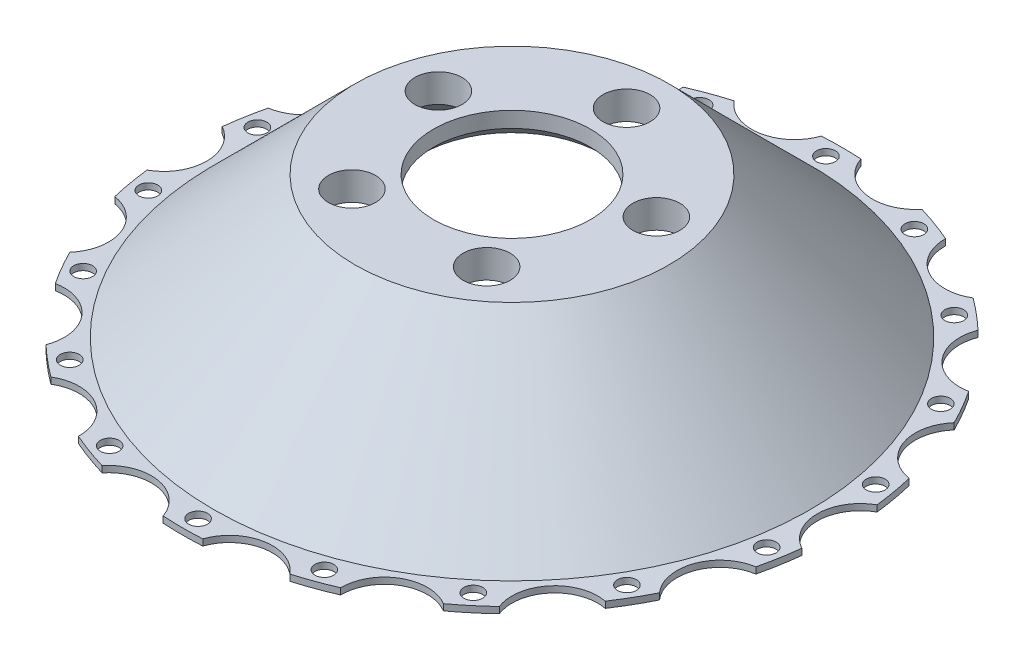
from build123d import *

# Parameters (mm, degrees)
SKETCH1_R           = 105
BOSS_EXTRUDE1_DEPTH = 2
BOSS_EXTRUDE2_START = 2
SKETCH2_R           = 95
BOSS_EXTRUDE2_DEPTH = 45
BOSS_EXTRUDE2_TAPER = 45
CUT_EXTRUDE2_START  = 2
SKETCH3_R           = 95
CUT_EXTRUDE2_DEPTH  = 40
CUT_EXTRUDE2_DRAFT  = -45
CUT_EXTRUDE3_REACH  = 157.753
SKETCH4_R           = 25
CHAMFER7_SIZE       = 4
CUT_EXTRUDE4_REACH  = 157.753
SKETCH7_R           = 7.5
CIRPATTERN1_COUNT   = 5
CUT_EXTRUDE5_REACH  = 157.753
SKETCH10_R          = 3
CIRPATTERN2_COUNT   = 18
CUT_EXTRUDE7_REACH  = 157.161
SKETCH12_R          = 13.691963716
CIRPATTERN4_COUNT   = 18


with BuildPart() as part:
    # Sketch1 → Boss-Extrude1 (new body)
    with BuildSketch(Plane(origin=(0, 0, 0), x_dir=(1, 0, 0), z_dir=(0, 1, 0))):
        Circle(SKETCH1_R)
    extrude(amount=BOSS_EXTRUDE1_DEPTH)

    # Sketch2 → Boss-Extrude2 (add)
    with BuildSketch(Plane(origin=(0, 0, 0), x_dir=(1, 0, 0), z_dir=(0, 1, 0)).offset(BOSS_EXTRUDE2_START)):
        Circle(SKETCH2_R)
    extrude(amount=BOSS_EXTRUDE2_DEPTH, taper=BOSS_EXTRUDE2_TAPER)


with BuildPart() as cut_extrude2_tool:
    # Sketch3 → Cut-Extrude2 (with draft: the straight prism first)
    with BuildSketch(Plane.XZ.offset(CUT_EXTRUDE2_START)):
        Circle(SKETCH3_R)
    extrude(amount=-CUT_EXTRUDE2_DEPTH)
    # Cut-Extrude2: the draft: its side faces are tilted about the plane it starts from
    cut_extrude2_sides = [cut_extrude2_tool.faces().sort_by_distance(p)[0] for p in [
        (-95, 18, 0),
    ]]
    draft(cut_extrude2_sides, Plane.XZ.offset(CUT_EXTRUDE2_START), CUT_EXTRUDE2_DRAFT)


with BuildPart() as part_1:
    add(part.part)

    # Cut-Extrude2: cut by cut_extrude2_tool
    add(cut_extrude2_tool.part, mode=Mode.SUBTRACT)

    # Sketch4 → Cut-Extrude3 (cut, up to next)
    with BuildSketch(Plane(origin=(0, 47, 0), x_dir=(1, 0, 0), z_dir=(0, 1, 0)), mode=Mode.PRIVATE) as cut_extrude3_sk1:
        Circle(SKETCH4_R)
    cut_extrude3_tool1 = extrude(cut_extrude3_sk1.sketch, amount=-CUT_EXTRUDE3_REACH, mode=Mode.PRIVATE) & part_1.part
    add(cut_extrude3_tool1.solids().sort_by_distance((0, 47, 0))[0], mode=Mode.SUBTRACT)

    # Chamfer7
    chamfer7_edges = [part_1.edges().sort_by_distance(p)[0] for p in [
        (-25, 38, 0),
    ]]
    chamfer(chamfer7_edges, length=CHAMFER7_SIZE)

    # Sketch7 → Cut-Extrude4 (cut, up to next)
    with BuildSketch(Plane(origin=(0, 47, 0), x_dir=(1, 0, 0), z_dir=(0, 1, 0)), mode=Mode.PRIVATE) as cut_extrude4_sk1:
        with Locations((0, 36.5)):
            Circle(SKETCH7_R)
    cut_extrude4_tool1 = extrude(cut_extrude4_sk1.sketch, amount=-CUT_EXTRUDE4_REACH, mode=Mode.PRIVATE) & part_1.part
    cut_extrude4 = cut_extrude4_tool1.solids().sort_by_distance((0, 47, -36.5))[0]
    add(cut_extrude4, mode=Mode.SUBTRACT)

    # CirPattern1: Cut-Extrude4 ×5 about axis
    cirpattern1_axis = Axis((0, 47, 0), (0, 1, 0))
    for i in range(1, CIRPATTERN1_COUNT):
        add(cut_extrude4.rotate(cirpattern1_axis, i * 360 / CIRPATTERN1_COUNT), mode=Mode.SUBTRACT)

    # Sketch10 → Cut-Extrude5 (cut, up to next)
    with BuildSketch(Plane(origin=(0, 0, 0), x_dir=(1, 0, 0), z_dir=(0, 1, 0)), mode=Mode.PRIVATE) as cut_extrude5_sk1:
        with Locations((0, 100)):
            Circle(SKETCH10_R)
    cut_extrude5_tool1 = extrude(cut_extrude5_sk1.sketch, amount=CUT_EXTRUDE5_REACH, mode=Mode.PRIVATE) & part_1.part
    cut_extrude5 = cut_extrude5_tool1.solids().sort_by_distance((0, 0, -100))[0]
    add(cut_extrude5, mode=Mode.SUBTRACT)

    # CirPattern2: Cut-Extrude5 ×18 about axis
    cirpattern2_axis = Axis((0, 2, 0), (0, 1, 0))
    for i in range(1, CIRPATTERN2_COUNT):
        add(cut_extrude5.rotate(cirpattern2_axis, i * 360 / CIRPATTERN2_COUNT), mode=Mode.SUBTRACT)

    # Cut-Sweep2: sweep along a curve in space
    with BuildLine() as cut_sweep2_path:
        ThreePointArc((0, 38, -55), (38.890872965, 38, -38.890872965), (55, 38, 0))
        ThreePointArc((55, 38, 0), (38.890872965, 38, 38.890872965), (0, 38, 55))
        ThreePointArc((0, 38, 55), (-38.890872965, 38, 38.890872965), (-55, 38, 0))
        ThreePointArc((-55, 38, 0), (-38.890872965, 38, -38.890872965), (0, 38, -55))
    # Sketch9 → Cut-Sweep2 (sweep, cut)
    with BuildSketch(Plane.XY.offset(-13)):
        with BuildLine():
            Line((48.868817725, 37.664960803), (53.784539882, 37.664960803))
            ThreePointArc((53.784539882, 37.664960803), (51.326678803, 39.465568412), (48.868817725, 37.664960803))
        make_face()
    sweep(path=cut_sweep2_path.line, mode=Mode.SUBTRACT)

    # Sketch12 → Cut-Extrude7 (cut, up to next)
    with BuildSketch(Plane(origin=(0, 2, 0), x_dir=(1, 0, 0), z_dir=(0, 1, 0)), mode=Mode.PRIVATE) as cut_extrude7_sk1:
        with Locations((19.25, -109.268280872)):
            Circle(SKETCH12_R)
    cut_extrude7_tool1 = extrude(cut_extrude7_sk1.sketch, amount=-CUT_EXTRUDE7_REACH, mode=Mode.PRIVATE) & part_1.part
    cut_extrude7 = cut_extrude7_tool1.solids().sort_by_distance((19.25, 2, 109.268281))[0]
    add(cut_extrude7, mode=Mode.SUBTRACT)

    # CirPattern4: Cut-Extrude7 ×18 about axis
    cirpattern4_axis = Axis((0, 2, 0), (0, 1, 0))
    for i in range(1, CIRPATTERN4_COUNT):
        add(cut_extrude7.rotate(cirpattern4_axis, i * 360 / CIRPATTERN4_COUNT), mode=Mode.SUBTRACT)


solid = part_1.part
